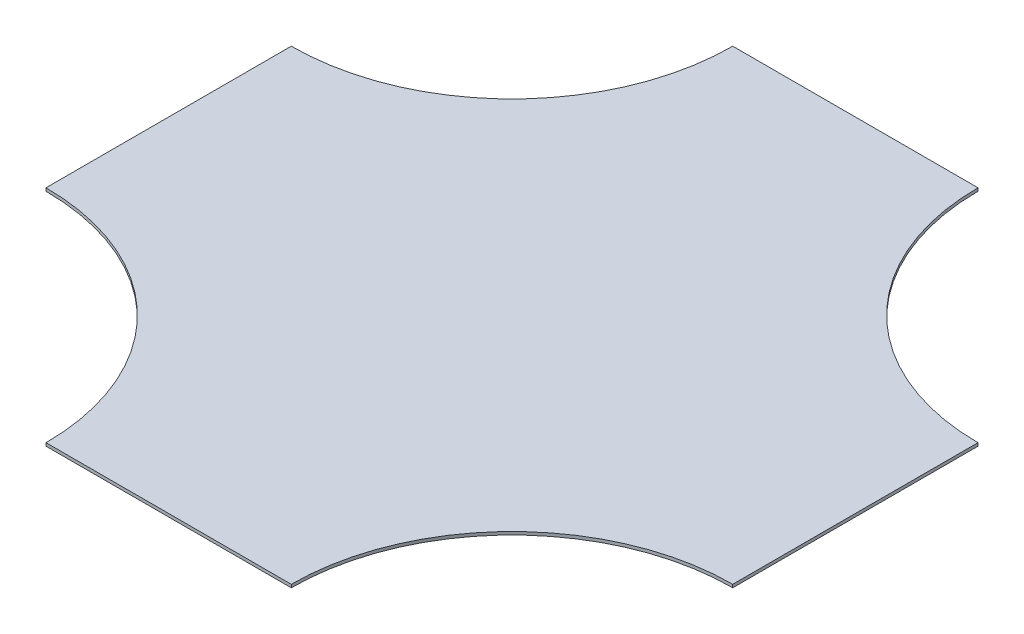
from build123d import *

# Parameters (mm, degrees)
BOSS_EXTRUDE1_DEPTH = 3.175


with BuildPart() as part:
    # Sketch1 → Boss-Extrude1 (new body)
    with BuildSketch(Plane(origin=(0, 0, 0), x_dir=(1, 0, 0), z_dir=(0, 1, 0))):
        with BuildLine():
            Line((-127, -355.6), (127, -355.6))
            ThreePointArc((127, -355.6), (193.955389821, -193.955389821), (355.6, -127))
            Line((355.6, -127), (355.6, 127))
            ThreePointArc((355.6, 127), (193.955389821, 193.955389821), (127, 355.6))
            Line((127, 355.6), (-127, 355.6))
            ThreePointArc((-127, 355.6), (-193.955389821, 193.955389821), (-355.6, 127))
            Line((-355.6, 127), (-355.6, -127))
            ThreePointArc((-355.6, -127), (-193.955389821, -193.955389821), (-127, -355.6))
        make_face()
    extrude(amount=BOSS_EXTRUDE1_DEPTH)


solid = part.part
